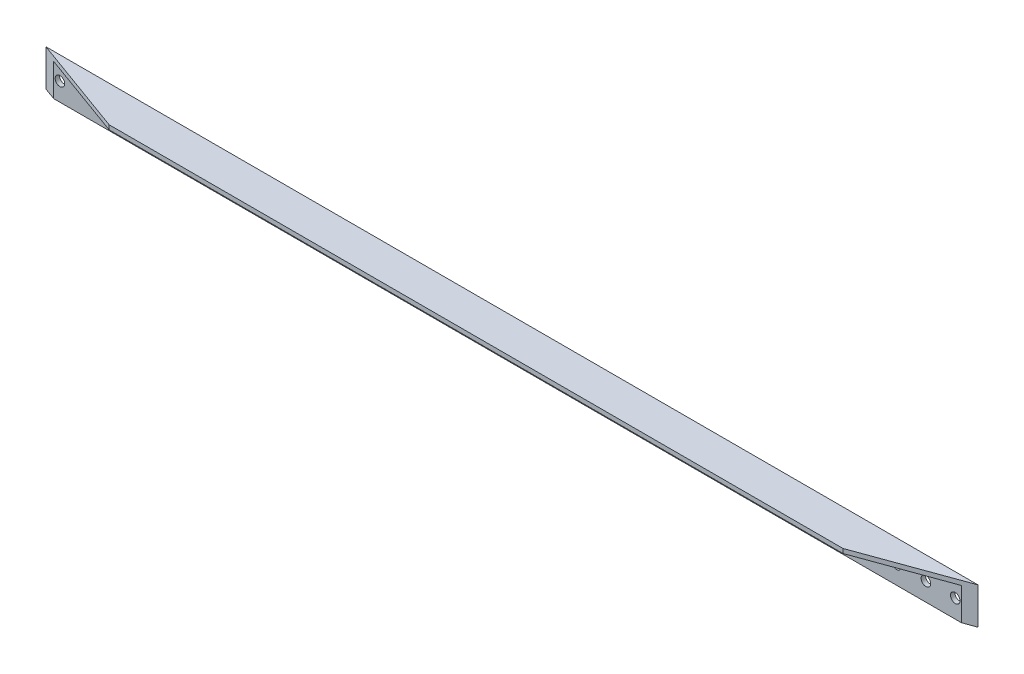
from build123d import *

# Parameters (mm, degrees)
SKETCH_1_W          = 2540
SKETCH_1_H          = 100
SKETCH_1_R          = 13
EXTRUDE_520_DEPTH   = 12
SKETCH_2_W          = 2540
SKETCH_2_H          = 12
EXTRUDE_1_DEPTH     = 86
CUT_EXTRUDE_1_DEPTH = 1278.694799238


with BuildPart() as part:
    # 草图1 → Extrude 520 (new body)
    with BuildSketch(Plane.XY):
        Rectangle(SKETCH_1_W, SKETCH_1_H)
        with Locations((1220, 0)):
            Circle(SKETCH_1_R, mode=Mode.SUBTRACT)
        with Locations((1140, 0)):
            Circle(SKETCH_1_R, mode=Mode.SUBTRACT)
        with Locations((1060, 0)):
            Circle(SKETCH_1_R, mode=Mode.SUBTRACT)
        with Locations((980, 0)):
            Circle(SKETCH_1_R, mode=Mode.SUBTRACT)
        with Locations((580, 0)):
            Circle(SKETCH_1_R, mode=Mode.SUBTRACT)
        with Locations((460, 0)):
            Circle(SKETCH_1_R, mode=Mode.SUBTRACT)
        with Locations((380, 0)):
            Circle(SKETCH_1_R, mode=Mode.SUBTRACT)
        with Locations((300, 0)):
            Circle(SKETCH_1_R, mode=Mode.SUBTRACT)
        with Locations((180, 0)):
            Circle(SKETCH_1_R, mode=Mode.SUBTRACT)
        with Locations((-180, 0)):
            Circle(SKETCH_1_R, mode=Mode.SUBTRACT)
        with Locations((-300, 0)):
            Circle(SKETCH_1_R, mode=Mode.SUBTRACT)
        with Locations((-380, 0)):
            Circle(SKETCH_1_R, mode=Mode.SUBTRACT)
        with Locations((-460, 0)):
            Circle(SKETCH_1_R, mode=Mode.SUBTRACT)
        with Locations((-580, 0)):
            Circle(SKETCH_1_R, mode=Mode.SUBTRACT)
        with Locations((-980, 0)):
            Circle(SKETCH_1_R, mode=Mode.SUBTRACT)
        with Locations((-1060, 0)):
            Circle(SKETCH_1_R, mode=Mode.SUBTRACT)
        with Locations((-1140, 0)):
            Circle(SKETCH_1_R, mode=Mode.SUBTRACT)
        with Locations((-1220, 0)):
            Circle(SKETCH_1_R, mode=Mode.SUBTRACT)
    extrude(amount=EXTRUDE_520_DEPTH)

    # 草图2 → 凸台-拉伸1 (add)
    with BuildSketch(Plane.XY.offset(12)):
        with Locations((0, 44)):
            Rectangle(SKETCH_2_W, SKETCH_2_H)
    extrude(amount=EXTRUDE_1_DEPTH)

    # 草图4 → 切除-拉伸1 (cut, through all)
    with BuildSketch(Plane(origin=(0, 50, 0), x_dir=(-1, 0, 0), z_dir=(0, 1, 0))):
        Polygon((-1270, 0), (-1270, 98), (-1000, 98), align=None)
        Polygon((1270, 0), (1000, 98), (1270, 98), align=None)
    extrude(amount=-CUT_EXTRUDE_1_DEPTH, mode=Mode.SUBTRACT)


solid = part.part
